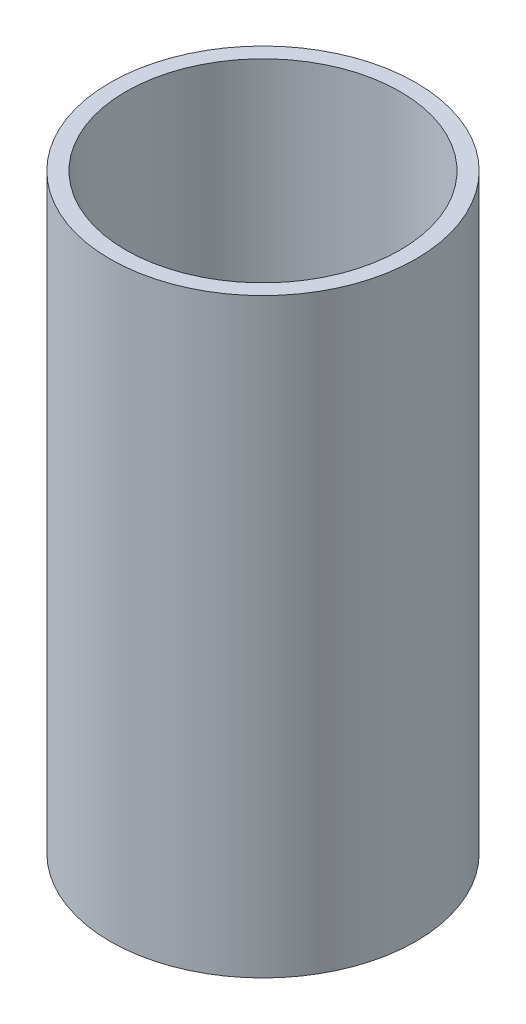
from build123d import *

# Parameters (mm, degrees)
SKETCH1_R           = 42.5
BOSS_EXTRUDE1_DEPTH = 164.294950148
SKETCH2_R           = 38.147213779
CUT_EXTRUDE1_DEPTH  = 175.943792814


with BuildPart() as part:
    # Sketch1 → Boss-Extrude1 (new body)
    with BuildSketch(Plane(origin=(0, 0, 0), x_dir=(1, 0, 0), z_dir=(0, 1, 0))):
        Circle(SKETCH1_R)
    extrude(amount=BOSS_EXTRUDE1_DEPTH)

    # Sketch2 → Cut-Extrude1 (cut, through all)
    with BuildSketch(Plane(origin=(0, 0, 0), x_dir=(1, 0, 0), z_dir=(0, 1, 0))):
        Circle(SKETCH2_R)
    extrude(amount=CUT_EXTRUDE1_DEPTH, mode=Mode.SUBTRACT)


solid = part.part
